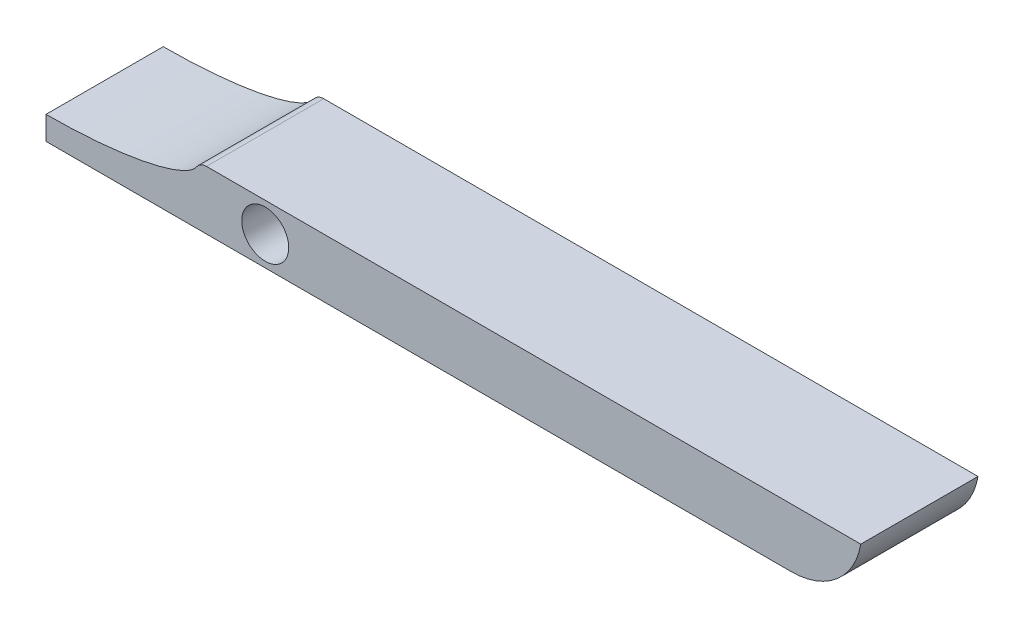
from build123d import *

# Parameters (mm, degrees)
SKETCH1_W             = 34.75
SKETCH1_H             = 5
BOSS_EXTRUDE1_DEPTH   = 2.5
F_1_0MM_DOWEL_HOLE1_D = 2.005
SKETCH15_RX           = 6.5
SKETCH15_RY           = 1.5
CUT_EXTRUDE1_DEPTH    = 10
FILLET1_START         = -3
FILLET1_DEPTH         = 6
FILLET2_R             = 3


with BuildPart() as part:
    # Sketch1 → Boss-Extrude1 (new body)
    with BuildSketch(Plane(origin=(0, 0, 0), x_dir=(1, 0, 0), z_dir=(0, 1, 0))):
        Rectangle(SKETCH1_W, SKETCH1_H)
    extrude(amount=BOSS_EXTRUDE1_DEPTH)

    # Ø1.0mm Dowel Hole1 (through all)
    with Locations(Plane.XY.offset(2.5)):
        with Locations((-8.025, 1.25)):
            Hole(F_1_0MM_DOWEL_HOLE1_D / 2)

    # Sketch15 → Cut-Extrude1 (cut)
    with BuildSketch(Plane.XY.offset(2.5)):
        with Locations((-17.375, 2.5)):
            Ellipse(SKETCH15_RX, SKETCH15_RY)
    extrude(amount=-CUT_EXTRUDE1_DEPTH, mode=Mode.SUBTRACT)

    # Fillet1: read off the stored shape, not the designer's step
    # Fillet1 outline → Fillet1 (cut)
    with BuildSketch(Plane.XY.offset(FILLET1_START)):
        with BuildLine():
            ThreePointArc((-10.948655177, 2.274826432), (-10.768220883, 2.440121129), (-10.530958598, 2.5))
            Line((-10.530958598, 2.5), (-10.875, 2.5))
            add(Edge.make_bspline(
                [(-10.948655177, 2.274826432), (-10.875, 2.386771689), (-10.875, 2.5)],
                knots=[6.120582714, 6.120582714, 6.120582714, 6.283185307, 6.283185307, 6.283185307], degree=2, weights=[0.94563875, 0.969680858, 1]))
        make_face()
    extrude(amount=FILLET1_DEPTH, mode=Mode.SUBTRACT)

    # Fillet2
    # the kernel refuses this fillet: 3 mm, written as the material it takes off along each edge
    with BuildSketch(Plane(origin=(17.375, 0, -9.895099729), x_dir=(-1, 0, 0), z_dir=(0, 0, 1))) as fillet2_piece_1:
        with BuildLine():
            CenterArc((2.958039892, -3), FILLET2_R, 90, 80.405931773)
            Line((0, -2.5), (-0.059160798, -2.49))
            ThreePointArc((-0.059160798, -2.49), (-0.06, -1.25), (-0.06, 0))
            Line((-0.06, 0), (0, 0.06))
            Line((0, 0.06), (2.958039892, 0.06))
            Line((2.958039892, 0.06), (2.958039892, 0))
        make_face()
    extrude(amount=19.790199458, mode=Mode.SUBTRACT)


solid = part.part
